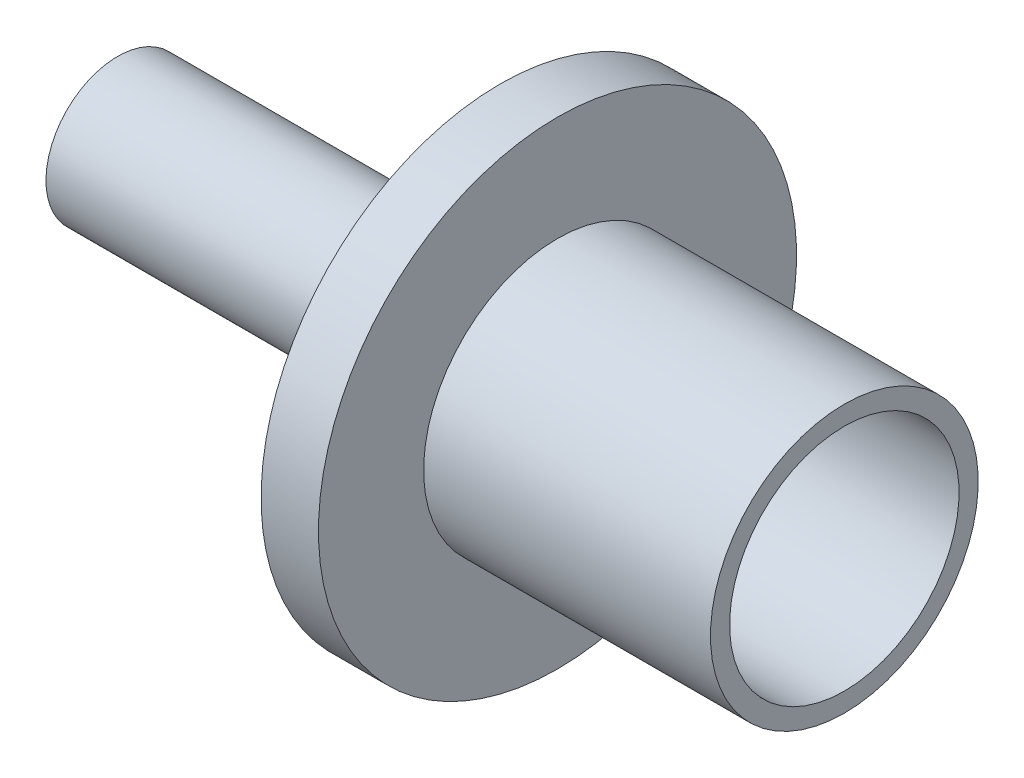
from build123d import *


with BuildPart() as part:
    # Sketch1 → Revolve1 (revolve)
    with BuildSketch(Plane.XY):
        Polygon((-6, 25), (-6, 7.5), (-46, 7.5), (-46, 6.5), (-3, 6.5), (-3, 10), (0, 10), (0, 12), (30, 12), (30, 14), (0, 14), (0, 25), align=None)
    revolve(axis=Axis((-64.900117457, 0, 0), (1, 0, 0)))


solid = part.part
